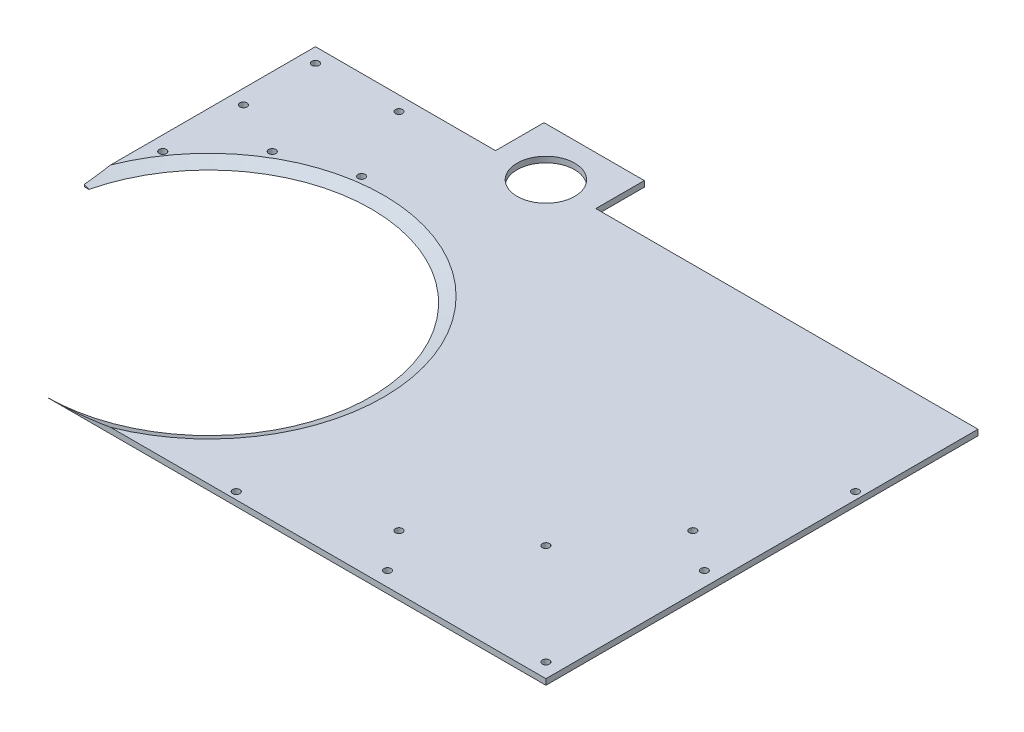
from build123d import *

# Parameters (mm, degrees)
BOSS_EXTRUDE1_START = 33.02
BOSS_EXTRUDE1_DEPTH = 5.08
SKETCH4_R           = 25.4
CUT_EXTRUDE1_DEPTH  = 50.8
CUT_EXTRUDE5_START  = 5.08
SKETCH1_R           = 143.404424797
CUT_EXTRUDE5_DEPTH  = 38.1
CHAMFER1_SIZE2      = 5.08
CHAMFER1_SIZE       = 10.894095156
SKETCH6_W           = 33.782
SKETCH6_H           = 14.432407555
CUT_EXTRUDE7_DEPTH  = 25.4
SKETCH7_R           = 3.175
CUT_EXTRUDE8_DEPTH  = 5.08
SKETCH8_R           = 3.175
CUT_EXTRUDE9_DEPTH  = 5.08


with BuildPart() as part:
    # Sketch2 → Boss-Extrude1 (new body)
    with BuildSketch(Plane(origin=(0, 0, 0), x_dir=(1, 0, 0), z_dir=(0, 1, 0)).offset(BOSS_EXTRUDE1_START)):
        Polygon((-203.2, 381), (-44.423028516, 381), (-44.423028516, 423.747508854), (44.020558762, 423.747508854), (44.020558762, 381), (381, 381), (381, 0), (-203.2, 0), align=None)
    extrude(amount=BOSS_EXTRUDE1_DEPTH)

    # Sketch4 → Cut-Extrude1 (cut)
    with BuildSketch(Plane.XZ.offset(-33.02)):
        with Locations(Location((0, -381, 0), (0, 0, 270))):
            Circle(SKETCH4_R)
    extrude(amount=-CUT_EXTRUDE1_DEPTH, mode=Mode.SUBTRACT)

    # Sketch1 → Cut-Extrude5 (cut)
    with BuildSketch(Plane(origin=(0, 0, 0), x_dir=(1, 0, 0), z_dir=(0, 1, 0)).offset(CUT_EXTRUDE5_START)):
        with Locations((-59.795575203, 143.404424797)):
            Circle(SKETCH1_R)
    extrude(amount=CUT_EXTRUDE5_DEPTH, mode=Mode.SUBTRACT)


with BuildPart() as cut_extrude5_kept_piece:
    # of the separate pieces the step leaves, the one the design keeps (cut_extrude5_pieces_kept)
    add(part.part.solids().sort_by_distance((-203.2, 33.02, -381))[0])

    # Chamfer1
    chamfer1_edges = [cut_extrude5_kept_piece.edges().sort_by_distance(p)[0] for p in [
        (41.606666023, 38.1, -244.806666023),
    ]]
    chamfer1_side = [cut_extrude5_kept_piece.faces().sort_by_distance(p)[0] for p in [
        (41.678508072, 38.1, -244.878508072),
    ]]
    chamfer(chamfer1_edges, length=CHAMFER1_SIZE - 0.0001, length2=CHAMFER1_SIZE2 - 0.0001, reference=chamfer1_side[0])  # a hair under: the kernel refuses the full size

    # Sketch6 → Cut-Extrude7 (cut)
    with BuildSketch(Plane.ZY.offset(203.2)):
        with Locations((-160.295424797, 40.236203778)):
            Rectangle(SKETCH6_W, SKETCH6_H)
    extrude(amount=-CUT_EXTRUDE7_DEPTH, mode=Mode.SUBTRACT)

    # Sketch7 → Cut-Extrude8 (cut)
    with BuildSketch(Plane(origin=(0, 38.1, 0), x_dir=(1, 0, 0), z_dir=(0, 1, 0))):
        with Locations(Location((368.3, 152.4, 0), (0, 0, 270))):
            Circle(SKETCH7_R)
        with Locations(Location((374.65, 279.4, 0), (0, 0, 270))):
            Circle(SKETCH7_R)
        with Locations(Location((332.74, 177.8, 0), (0, 0, 270))):
            Circle(SKETCH7_R)
        with Locations(Location((279.4, 101.6, 0), (0, 0, 270))):
            Circle(SKETCH7_R)
        with Locations(Location((101.6, 6.35, 0), (0, 0, 270))):
            Circle(SKETCH7_R)
        with Locations(Location((203.2, 48.26, 0), (0, 0, 270))):
            Circle(SKETCH7_R)
        with Locations(Location((228.6, 12.7, 0), (0, 0, 270))):
            Circle(SKETCH7_R)
        with Locations(Location((368.3, 12.7, 0), (0, 0, 270))):
            Circle(SKETCH7_R)
    extrude(amount=-CUT_EXTRUDE8_DEPTH, mode=Mode.SUBTRACT)

    # Sketch8 → Cut-Extrude9 (cut)
    with BuildSketch(Plane(origin=(0, 38.1, 0), x_dir=(1, 0, 0), z_dir=(0, 1, 0))):
        with Locations(Location((-190.5, 368.3, 0), (0, 0, 270))):
            Circle(SKETCH8_R)
        with Locations(Location((-116.84, 368.3, 0), (0, 0, 270))):
            Circle(SKETCH8_R)
        with Locations(Location((-83.82, 302.26, 0), (0, 0, 270))):
            Circle(SKETCH8_R)
        with Locations(Location((-142.24, 281.94, 0), (0, 0, 270))):
            Circle(SKETCH8_R)
        with Locations(Location((-190.5, 304.8, 0), (0, 0, 270))):
            Circle(SKETCH8_R)
        with Locations(Location((-190.5, 233.68, 0), (0, 0, 270))):
            Circle(SKETCH8_R)
    extrude(amount=-CUT_EXTRUDE9_DEPTH, mode=Mode.SUBTRACT)


solid = cut_extrude5_kept_piece.part
